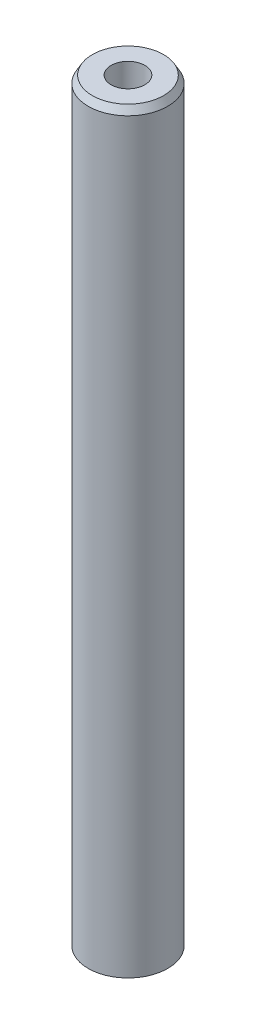
from build123d import *
from OCP.BRepFilletAPI import BRepFilletAPI_MakeChamfer

# Parameters (mm, degrees)
SKETCH1_R           = 30
BOSS_EXTRUDE1_DEPTH = 571.957207302
SKETCH2_R           = 12.733296072
CUT_EXTRUDE1_DEPTH  = 574.528592997
CHAMFER1_SIZE       = 5.41710872
CHAMFER1_SIZE2      = 3.127569178


with BuildPart() as part:
    # Sketch1 → Boss-Extrude1 (new body)
    with BuildSketch(Plane(origin=(0, 0, 0), x_dir=(1, 0, 0), z_dir=(0, 1, 0))):
        Circle(SKETCH1_R)
    extrude(amount=BOSS_EXTRUDE1_DEPTH)

    # Sketch2 → Cut-Extrude1 (cut, through all)
    with BuildSketch(Plane(origin=(0, 0, 0), x_dir=(1, 0, 0), z_dir=(0, 1, 0))):
        Circle(SKETCH2_R)
    extrude(amount=CUT_EXTRUDE1_DEPTH, mode=Mode.SUBTRACT)

    # Chamfer1: one chamfer whose edges measure the first distance from different faces: ONE call of the kernel's chamfer builder (chamfer() names one face for all edges)
    chamfer1_edges_1 = [part.edges().sort_by_distance(p)[0] for p in [
        (-30, 571.957207302, 0),
    ]]
    chamfer1_side_1 = [part.faces().sort_by_distance(p)[0] for p in [
        (-30, 285.978603651, 0),
    ]]
    chamfer1_edges_2 = [part.edges().sort_by_distance(p)[0] for p in [
        (-30, 0, 0),
    ]]
    chamfer1_side_2 = [part.faces().sort_by_distance(p)[0] for p in [
        (-29.151471863, 0, 0),
    ]]
    chamfer1 = BRepFilletAPI_MakeChamfer(part.part.solid().wrapped)
    for e in chamfer1_edges_1:
        chamfer1.Add(CHAMFER1_SIZE, CHAMFER1_SIZE2, e.wrapped, chamfer1_side_1[0].wrapped)  # the first distance lies on this face
    for e in chamfer1_edges_2:
        chamfer1.Add(CHAMFER1_SIZE, CHAMFER1_SIZE2, e.wrapped, chamfer1_side_2[0].wrapped)  # the first distance lies on this face
    add(Compound.cast(chamfer1.Shape()), mode=Mode.REPLACE)


solid = part.part
